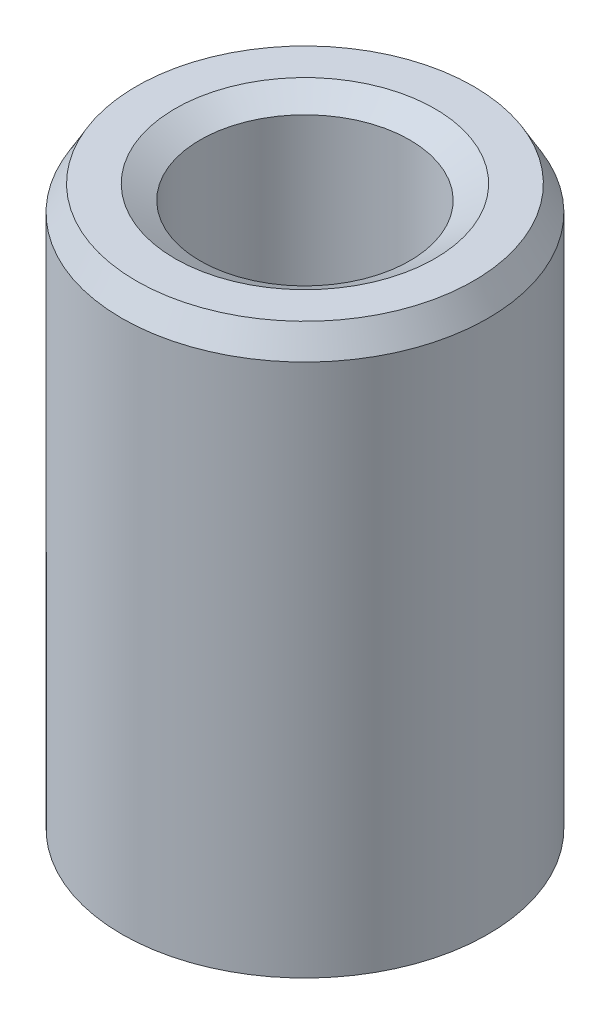
from build123d import *
from OCP.BRepFilletAPI import BRepFilletAPI_MakeChamfer

# Parameters (mm, degrees)
SKETCH1_R           = 10
BOSS_EXTRUDE1_DEPTH = 31.296126969
SKETCH2_R           = 5.725271062
CUT_EXTRUDE1_DEPTH  = 35.343086105
CHAMFER1_SIZE       = 1.370313199
CHAMFER1_SIZE2      = 0.791150694


with BuildPart() as part:
    # Sketch1 → Boss-Extrude1 (new body)
    with BuildSketch(Plane(origin=(0, 0, 0), x_dir=(1, 0, 0), z_dir=(0, 1, 0))):
        Circle(SKETCH1_R)
    extrude(amount=BOSS_EXTRUDE1_DEPTH)

    # Sketch2 → Cut-Extrude1 (cut, through all)
    with BuildSketch(Plane(origin=(0, 0, 0), x_dir=(1, 0, 0), z_dir=(0, 1, 0))):
        Circle(SKETCH2_R)
    extrude(amount=CUT_EXTRUDE1_DEPTH, mode=Mode.SUBTRACT)

    # Chamfer1: one chamfer whose edges measure the first distance from different faces: ONE call of the kernel's chamfer builder (chamfer() names one face for all edges)
    chamfer1_edges_1 = [part.edges().sort_by_distance(p)[0] for p in [
        (-5.725271062, 31.296126969, 0),
    ]]
    chamfer1_side_1 = [part.faces().sort_by_distance(p)[0] for p in [
        (-9.717157288, 31.296126969, 0),
    ]]
    chamfer1_edges_2 = [part.edges().sort_by_distance(p)[0] for p in [
        (-5.725271062, 0, 0),
    ]]
    chamfer1_side_2 = [part.faces().sort_by_distance(p)[0] for p in [
        (-5.725271062, 15.648063484, 0),
    ]]
    chamfer1_edges_3 = [part.edges().sort_by_distance(p)[0] for p in [
        (-10, 0, 0),
    ]]
    chamfer1_side_3 = [part.faces().sort_by_distance(p)[0] for p in [
        (-9.717157288, 0, 0),
    ]]
    chamfer1_edges_4 = [part.edges().sort_by_distance(p)[0] for p in [
        (-10, 31.296126969, 0),
    ]]
    chamfer1_side_4 = [part.faces().sort_by_distance(p)[0] for p in [
        (-10, 15.648063484, 0),
    ]]
    chamfer1 = BRepFilletAPI_MakeChamfer(part.part.solid().wrapped)
    for e in chamfer1_edges_1:
        chamfer1.Add(CHAMFER1_SIZE, CHAMFER1_SIZE2, e.wrapped, chamfer1_side_1[0].wrapped)  # the first distance lies on this face
    for e in chamfer1_edges_2:
        chamfer1.Add(CHAMFER1_SIZE, CHAMFER1_SIZE2, e.wrapped, chamfer1_side_2[0].wrapped)  # the first distance lies on this face
    for e in chamfer1_edges_3:
        chamfer1.Add(CHAMFER1_SIZE, CHAMFER1_SIZE2, e.wrapped, chamfer1_side_3[0].wrapped)  # the first distance lies on this face
    for e in chamfer1_edges_4:
        chamfer1.Add(CHAMFER1_SIZE, CHAMFER1_SIZE2, e.wrapped, chamfer1_side_4[0].wrapped)  # the first distance lies on this face
    add(Compound.cast(chamfer1.Shape()), mode=Mode.REPLACE)


solid = part.part
